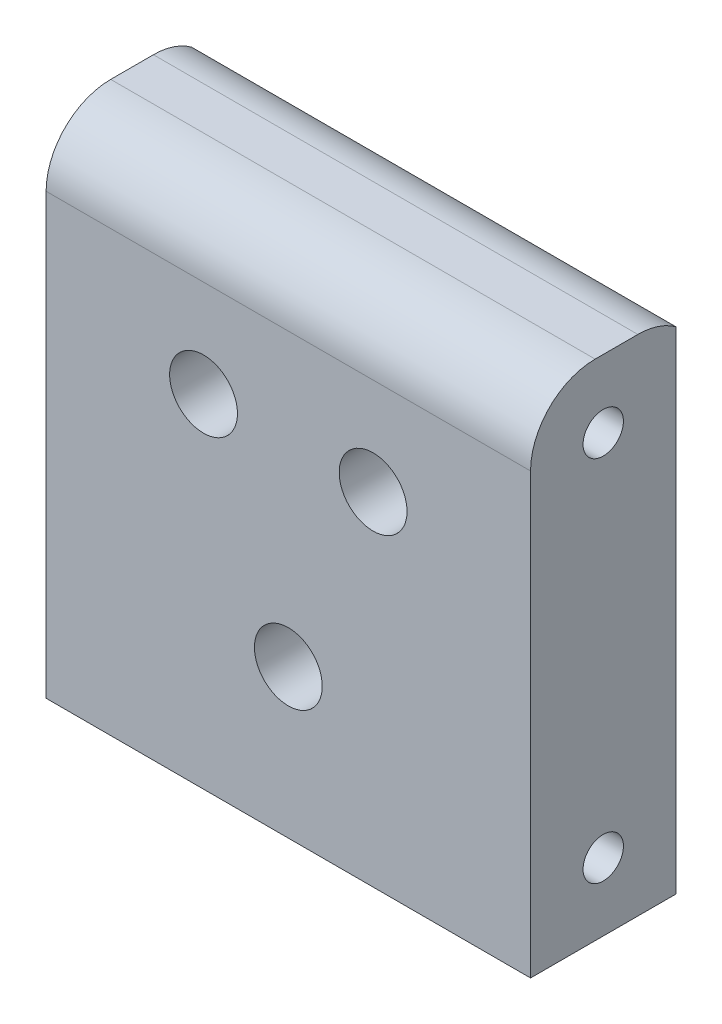
from build123d import *

# Parameters (mm, degrees)
MAINBODY_EXTRUDE_START                     = -15
MAINBODY_EXTRUDE_DEPTH                     = 30
VISESCREWSTHREADEDHOLES_CUT_DEPTH          = 23.101437038
VISESCREWSTHREADEDHOLES_CUT_DEPTH_BACK     = 23.101437038
VISESCREWSTHREADEDHOLES_SKETCH_R           = 2.1
CUT_EXTRUDE2_DEPTH                         = 24.435518325
CUT_EXTRUDE2_DEPTH_BACK                    = 19.935518325
CUT_EXTRUDE2_START                         = -4.5
THREADEDHOLEFORTERMINALSCREW_SKETCH_R      = 2.1
MOUNTINGHOLETOSIDEPLATESEEDFODDER_START    = -2.145727099
MOUNTINGHOLETOSIDEPLATESEEDFODDER_OUTLIN_W = 30
MOUNTINGHOLETOSIDEPLATESEEDFODDER_OUTLIN_H = 31.19125
MOUNTINGHOLETOSIDEPLATESEEDFODDER_OUTLIN_R = 2.1
MOUNTINGHOLETOSIDEPLATESEEDFODDER_DEPTH    = 2.645727099
MOUNTINGHOLETOSIDEPLATESEEDFODDER_START_2  = -15
MOUNTINGHOLETOSIDEPLATESEEDFODDER_2_DEPTH  = 30
MOUNTINGHOLETOSIDEPLATESEEDFODDER_START_3  = -4.5
MOUNTINGHOLETOSIDEPLATESEEDFODDER_3_OUTL_R = 2.1
MOUNTINGHOLETOSIDEPLATESEEDFODDER_3_DEPTH  = 9
MOUNTINGHOLETOSIDEPLATESEED_SKETCH_R       = 1.25
MOUNTINGHOLETOSIDEPLATESEED_CUT_DEPTH      = 23.101437038
MOUNTINGHOLESTOSIDEPLATE_PATTERN_START     = -15
MOUNTINGHOLESTOSIDEPLATE_PATTERN_OUTLINE_R = 1.25
MOUNTINGHOLESTOSIDEPLATE_PATTERN_DEPTH     = 30


with BuildPart() as part:
    # projectionX_sketch → mainBody_extrude (new body)
    with BuildSketch(Plane(origin=(0, 0, 0), x_dir=(0, 0, -1), z_dir=(1, 0, 0)).offset(MAINBODY_EXTRUDE_START)):
        with BuildLine():
            Line((-0.5, 15.595625), (2.145727099, 15.595625))
            ThreePointArc((2.145727099, 15.595625), (3.383636459, 15.399252271), (4.5, 14.829415207))
            Line((4.5, 14.829415207), (4.5, -15.595625))
            Line((4.5, -15.595625), (-4.5, -15.595625))
            Line((-4.5, -15.595625), (-4.5, 11.595625))
            ThreePointArc((-4.5, 11.595625), (-3.328427125, 14.424052125), (-0.5, 15.595625))
        make_face()
    extrude(amount=MAINBODY_EXTRUDE_DEPTH)

    # viseScrewsThreadedHoles_sketch → viseScrewsThreadedHoles_cut (cut, two sides: drawn at the far end of the back side and taken through both)
    with BuildSketch(Plane.XY.offset(-VISESCREWSTHREADEDHOLES_CUT_DEPTH_BACK)):
        with Locations((-5.25, 5.595625)):
            Circle(VISESCREWSTHREADEDHOLES_SKETCH_R)
        with Locations((5.25, 5.595625)):
            Circle(VISESCREWSTHREADEDHOLES_SKETCH_R)
    extrude(amount=VISESCREWSTHREADEDHOLES_CUT_DEPTH + VISESCREWSTHREADEDHOLES_CUT_DEPTH_BACK, mode=Mode.SUBTRACT)

    # threadedHoleForTerminalScrew_sketch → Cut-Extrude2 (cut, two sides: drawn at the far end of the back side and taken through both)
    with BuildSketch(Plane.XY.offset(4.5).offset(CUT_EXTRUDE2_START - CUT_EXTRUDE2_DEPTH_BACK)):
        with Locations((0, -6.404375)):
            Circle(THREADEDHOLEFORTERMINALSCREW_SKETCH_R)
    extrude(amount=CUT_EXTRUDE2_DEPTH + CUT_EXTRUDE2_DEPTH_BACK, mode=Mode.SUBTRACT)

    # mountingHolesToSidePlate_pattern: read off the stored shape, not the designer's step
    # mountingHolesToSidePlate_pattern outline → mountingHolesToSidePlate_pattern (cut)
    with BuildSketch(Plane.YZ.offset(MOUNTINGHOLESTOSIDEPLATE_PATTERN_START)):
        with Locations((-11.395625, 0)):
            Circle(MOUNTINGHOLESTOSIDEPLATE_PATTERN_OUTLINE_R)
        with Locations((11.395625, 0)):
            Circle(MOUNTINGHOLESTOSIDEPLATE_PATTERN_OUTLINE_R)
    extrude(amount=MOUNTINGHOLESTOSIDEPLATE_PATTERN_DEPTH, mode=Mode.SUBTRACT)


with BuildPart() as body_2:
    # mountingHoleToSidePlateSeedFodder: read off the stored shape, not the designer's step
    # mountingHoleToSidePlateSeedFodder outlin → mountingHoleToSidePlateSeedFodder (new body)
    with BuildSketch(Plane.XY.offset(MOUNTINGHOLETOSIDEPLATESEEDFODDER_START)):
        Rectangle(MOUNTINGHOLETOSIDEPLATESEEDFODDER_OUTLIN_W, MOUNTINGHOLETOSIDEPLATESEEDFODDER_OUTLIN_H)
        with Locations((0, -6.404375)):
            Circle(MOUNTINGHOLETOSIDEPLATESEEDFODDER_OUTLIN_R, mode=Mode.SUBTRACT)
        with Locations((-5.25, 5.595625)):
            Circle(MOUNTINGHOLETOSIDEPLATESEEDFODDER_OUTLIN_R, mode=Mode.SUBTRACT)
        with Locations((5.25, 5.595625)):
            Circle(MOUNTINGHOLETOSIDEPLATESEEDFODDER_OUTLIN_R, mode=Mode.SUBTRACT)
    extrude(amount=MOUNTINGHOLETOSIDEPLATESEEDFODDER_DEPTH)

    # mountingHoleToSidePlateSeedFodder 2 outl → mountingHoleToSidePlateSeedFodder 2 (add)
    with BuildSketch(Plane.YZ.offset(MOUNTINGHOLETOSIDEPLATESEEDFODDER_START_2)):
        with BuildLine():
            Line((15.595625, -2.145727099), (-15.595625, -2.145727099))
            Line((-15.595625, -2.145727099), (-15.595625, -4.5))
            Line((-15.595625, -4.5), (14.829415207, -4.5))
            ThreePointArc((14.829415207, -4.5), (15.399252271, -3.38363646), (15.595625, -2.145727099))
        make_face()
        with BuildLine():
            ThreePointArc((15.595625, 0.5), (14.424052125, 3.328427125), (11.595625, 4.5))
            Line((11.595625, 4.5), (-15.595625, 4.5))
            Line((-15.595625, 4.5), (-15.595625, 0.5))
            Line((-15.595625, 0.5), (15.595625, 0.5))
        make_face()
    extrude(amount=MOUNTINGHOLETOSIDEPLATESEEDFODDER_2_DEPTH)

    # mountingHoleToSidePlateSeedFodder 3 outl → mountingHoleToSidePlateSeedFodder 3 (cut)
    with BuildSketch(Plane.XY.offset(MOUNTINGHOLETOSIDEPLATESEEDFODDER_START_3)):
        with Locations((5.25, 5.595625)):
            Circle(MOUNTINGHOLETOSIDEPLATESEEDFODDER_3_OUTL_R)
        with Locations((-5.25, 5.595625)):
            Circle(MOUNTINGHOLETOSIDEPLATESEEDFODDER_3_OUTL_R)
        with Locations((0, -6.404375)):
            Circle(MOUNTINGHOLETOSIDEPLATESEEDFODDER_3_OUTL_R)
    extrude(amount=MOUNTINGHOLETOSIDEPLATESEEDFODDER_3_DEPTH, mode=Mode.SUBTRACT)

    # mountingHoleToSidePlateSeed_sketch → mountingHoleToSidePlateSeed_cut (cut, symmetric)
    with BuildSketch(Plane(origin=(0, 0, 0), x_dir=(0, 0, -1), z_dir=(1, 0, 0))):
        Circle(MOUNTINGHOLETOSIDEPLATESEED_SKETCH_R)
    extrude(amount=MOUNTINGHOLETOSIDEPLATESEED_CUT_DEPTH, both=True, mode=Mode.SUBTRACT)


solid = part.part
